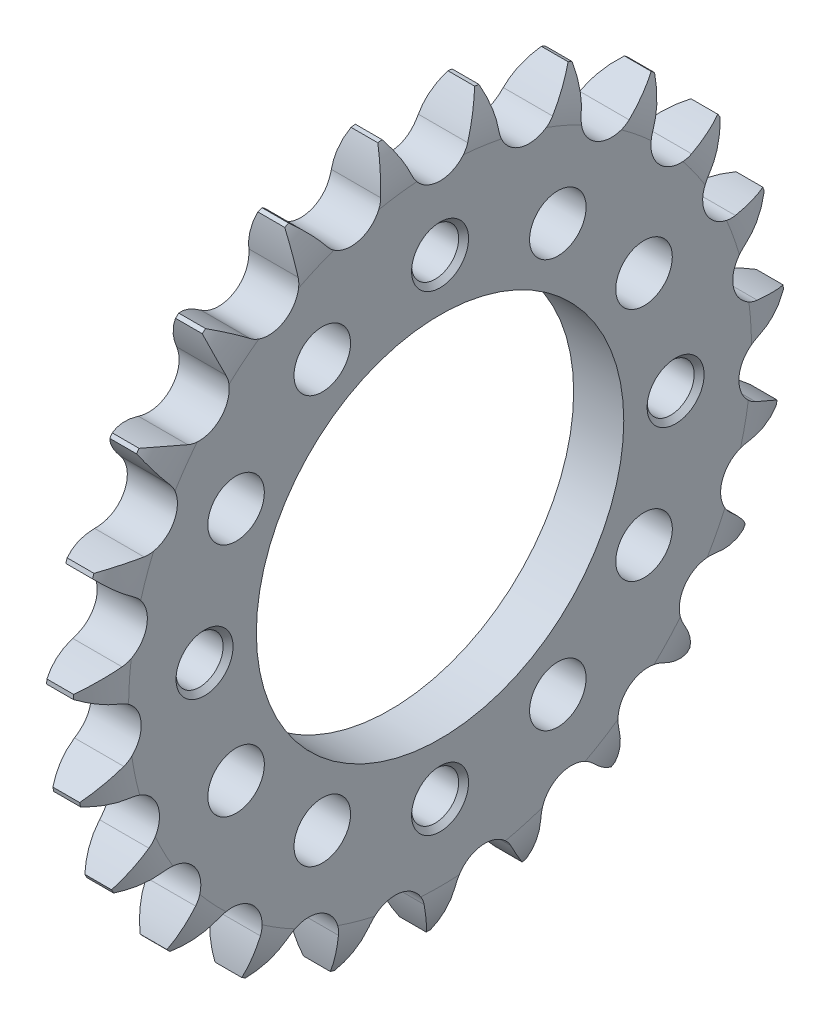
from build123d import *

# Parameters (mm, degrees)
TOOTHCUT_DEPTH              = 54.656074054
TEETHCUTS_COUNT             = 23
TEETHCUTS_ANGLE             = 344.347826087
BORSKE_R                    = 2
BORE_DEPTH                  = 50.0005
SKETCH1_R                   = 19.5
CUT_EXTRUDE1_DEPTH          = 10
M6_TAPPED_HOLE1_D           = 5
M6_TAPPED_HOLE1_CSINK_D     = 6.05
M6_TAPPED_HOLE1_CSINK_ANGLE = 90
SKETCH4_R                   = 3
CUT_EXTRUDE5_DEPTH          = 54.604697873
CIRPATTERN1_COUNT           = 12


with BuildPart() as part:
    # BasProSke → Base-Revolve (revolve)
    with BuildSketch(Plane(origin=(0, 0, 0), x_dir=(1, 0, 0), z_dir=(0, 1, 0)), mode=Mode.PRIVATE) as base_revolve_sk:
        with BuildLine():
            Line((0, 0), (0, 33.05777326))
            ThreePointArc((0, 33.05777326), (0.314698702, 35.485936145), (1.238, 37.753649749))
            Line((1.238, 37.753649749), (4.0816, 37.753649749))
            ThreePointArc((4.0816, 37.753649749), (5.004901298, 35.485936145), (5.3196, 33.05777326))
            Line((5.3196, 33.05777326), (5.3196, 0))
            Line((5.3196, 0), (0, 0))
        make_face()
    revolve(base_revolve_sk.sketch.rotate(Axis((-10, 0, 0), (1, 0, 0)), 180), axis=Axis((-10, 0, 0), (1, 0, 0)))

    # TooCutSke → ToothCut (cut, through all)
    with BuildSketch(Plane(origin=(0, 0, 0), x_dir=(0, 0, -1), z_dir=(1, 0, 0))):
        with BuildLine():
            ThreePointArc((2.97415754, 33.808261616), (3.980578959, 35.920428815), (5.23833278, 37.893292134))
            ThreePointArc((5.23833278, 37.893292134), (0, 38.253649749), (-5.23833278, 37.893292134))
            ThreePointArc((-5.23833278, 37.893292134), (-3.980578959, 35.920428815), (-2.97415754, 33.808261616))
            ThreePointArc((-2.97415754, 33.808261616), (0, 31.800524749), (2.97415754, 33.808261616))
        make_face()
    toothcut = extrude(amount=TOOTHCUT_DEPTH, mode=Mode.SUBTRACT)

    # TeethCuts: ToothCut ×23 about axis
    teethcuts_axis = Axis((-10, 0, 0), (1, 0, 0))
    for i in range(1, TEETHCUTS_COUNT):
        add(toothcut.rotate(teethcuts_axis, i * TEETHCUTS_ANGLE / (TEETHCUTS_COUNT - 1)), mode=Mode.SUBTRACT)

    # BorSke → Bore (cut, symmetric)
    with BuildSketch(Plane(origin=(0, 0, 0), x_dir=(0, 0, -1), z_dir=(1, 0, 0))):
        with Locations(Location((0, 0, 0), (0, 0, 180))):
            Circle(BORSKE_R)
    extrude(amount=BORE_DEPTH, both=True, mode=Mode.SUBTRACT)

    # Sketch1 → Cut-Extrude1 (cut)
    with BuildSketch(Plane(origin=(5.3196, 0, 0), x_dir=(0, 0, -1), z_dir=(1, 0, 0))):
        Circle(SKETCH1_R)
    extrude(amount=-CUT_EXTRUDE1_DEPTH, mode=Mode.SUBTRACT)

    # M6 Tapped Hole1 (through all)
    with Locations(Plane(origin=(5.3196, 0, 0), x_dir=(0, 0, -1), z_dir=(1, 0, 0))):
        with Locations((0, 25), (-25, 0), (25, 0), (0, -25)):
            CounterSinkHole(M6_TAPPED_HOLE1_D / 2, M6_TAPPED_HOLE1_CSINK_D / 2, counter_sink_angle=M6_TAPPED_HOLE1_CSINK_ANGLE)

    # Sketch4 → Cut-Extrude5 (cut, through all)
    with BuildSketch(Plane(origin=(5.3196, 0, 0), x_dir=(0, 0, -1), z_dir=(1, 0, 0))):
        with Locations((-21.650635095, 12.5)):
            Circle(SKETCH4_R)
    cut_extrude5 = extrude(amount=-CUT_EXTRUDE5_DEPTH, mode=Mode.SUBTRACT)

    # CirPattern1: Cut-Extrude5 ×12 about axis, 4 skipped
    cirpattern1_axis = Axis((-4.6804, 0, 0), (1, 0, 0))
    add([cut_extrude5.rotate(cirpattern1_axis, i * 360 / CIRPATTERN1_COUNT) for i in range(1, CIRPATTERN1_COUNT) if i not in (1, 4, 7, 10)], mode=Mode.SUBTRACT)


solid = part.part
